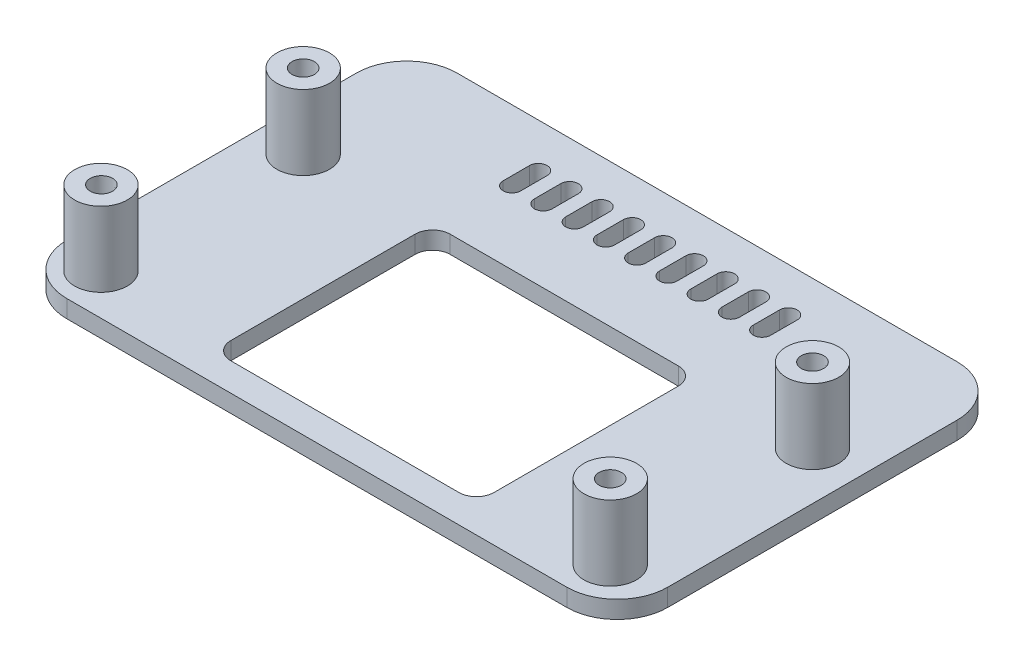
from build123d import *

# Parameters (mm, degrees)
SKETCH_1_W                    = 68.5
SKETCH_1_H                    = 44.5
EXTRUDE_1_DEPTH               = 2
FILLET_1_R                    = 5.75
SKETCH_2_W                    = 30
SKETCH_2_H                    = 25
CUT_EXTRUDE_1_DEPTH           = 43.75543475
FILLET_2_R                    = 2
SKETCH_3_R                    = 3
EXTRUDE_2_DEPTH               = 8.5
SKETCH_4_R                    = 1.275
CUT_EXTRUDE_2_DEPTH           = 6
CUT_EXTRUDE_2_DRAFT           = -1
CUT_EXTRUDE_2_PROFILE_2_DEPTH = 6
CUT_EXTRUDE_2_PROFILE_2_DRAFT = -1
CUT_EXTRUDE_2_PROFILE_3_DEPTH = 6
CUT_EXTRUDE_2_PROFILE_3_DRAFT = -1
CUT_EXTRUDE_2_PROFILE_4_DEPTH = 6
CUT_EXTRUDE_2_PROFILE_4_DRAFT = -1
CUT_EXTRUDE_3_DEPTH           = 10


with BuildPart() as part:
    # 草图1 → 凸台-拉伸1 (new body)
    with BuildSketch(Plane(origin=(0, 0, 0), x_dir=(1, 0, 0), z_dir=(0, 1, 0))):
        with Locations((-0.249435028, -2.925706215)):
            Rectangle(SKETCH_1_W, SKETCH_1_H)
    extrude(amount=EXTRUDE_1_DEPTH)

    # 圆角1
    fillet_1_edges = [part.edges().sort_by_distance(p)[0] for p in [
        (34.000564972, 1, -19.324293785),
        (34.000564972, 1, 25.175706215),
        (-34.499435028, 1, 25.175706215),
        (-34.499435028, 1, -19.324293785),
    ]]
    fillet(fillet_1_edges, radius=FILLET_1_R)

    # 草图2 → 切除-拉伸1 (cut, through all)
    with BuildSketch(Plane.XZ):
        with Locations((-0.249435028, 9.475706215)):
            Rectangle(SKETCH_2_W, SKETCH_2_H)
    extrude(amount=-CUT_EXTRUDE_1_DEPTH, mode=Mode.SUBTRACT)

    # 圆角2
    fillet_2_edges = [part.edges().sort_by_distance(p)[0] for p in [
        (-15.249435028, 1, -3.024293785),
        (-15.249435028, 1, 21.975706215),
        (14.750564972, 1, 21.975706215),
        (14.750564972, 1, -3.024293785),
    ]]
    fillet(fillet_2_edges, radius=FILLET_2_R)

    # 草图3 → 凸台-拉伸2 (add)
    with BuildSketch(Plane(origin=(0, 2, 0), x_dir=(1, 0, 0), z_dir=(0, 1, 0))):
        with Locations((-29.524435028, 2.549293785)):
            Circle(SKETCH_3_R)
        with Locations((-29.524435028, -20.500706215)):
            Circle(SKETCH_3_R)
        with Locations((28.500564972, -20.475706215)):
            Circle(SKETCH_3_R)
        with Locations((28.525564972, 2.549293785)):
            Circle(SKETCH_3_R)
    extrude(amount=EXTRUDE_2_DEPTH)


with BuildPart() as cut_extrude_2_tool:
    # 草图4 → 切除-拉伸2 (with draft: the straight prism first)
    with BuildSketch(Plane(origin=(0, 10.5, 0), x_dir=(1, 0, 0), z_dir=(0, 1, 0))):
        with Locations((-29.524435028, 2.549293785)):
            Circle(SKETCH_4_R)
    extrude(amount=-CUT_EXTRUDE_2_DEPTH)
    # 切除-拉伸2: the draft: its side faces are tilted about the plane it starts from
    cut_extrude_2_sides = [cut_extrude_2_tool.faces().sort_by_distance(p)[0] for p in [
        (-30.799435028, 7.5, -2.549293785),
    ]]
    draft(cut_extrude_2_sides, Plane(origin=(0, 10.5, 0), x_dir=(1, 0, 0), z_dir=(0, 1, 0)), CUT_EXTRUDE_2_DRAFT)


with BuildPart() as part_1:
    add(part.part)

    # 切除-拉伸2: cut by cut_extrude_2_tool
    add(cut_extrude_2_tool.part, mode=Mode.SUBTRACT)


with BuildPart() as cut_extrude_2_profile_2_tool:
    # 草图4 → 切除-拉伸2 profile 2 (with draft: the straight prism first)
    with BuildSketch(Plane(origin=(0, 10.5, 0), x_dir=(1, 0, 0), z_dir=(0, 1, 0))):
        with Locations((-29.499435028, -20.475706215)):
            Circle(SKETCH_4_R)
    extrude(amount=-CUT_EXTRUDE_2_PROFILE_2_DEPTH)
    # 切除-拉伸2 profile 2: the draft: its side faces are tilted about the plane it starts from
    cut_extrude_2_profile_2_sides = [cut_extrude_2_profile_2_tool.faces().sort_by_distance(p)[0] for p in [
        (-30.774435028, 7.5, 20.475706215),
    ]]
    draft(cut_extrude_2_profile_2_sides, Plane(origin=(0, 10.5, 0), x_dir=(1, 0, 0), z_dir=(0, 1, 0)), CUT_EXTRUDE_2_PROFILE_2_DRAFT)


with BuildPart() as part_2:
    add(part_1.part)

    # 切除-拉伸2 profile 2: cut by cut_extrude_2_profile_2_tool
    add(cut_extrude_2_profile_2_tool.part, mode=Mode.SUBTRACT)


with BuildPart() as cut_extrude_2_profile_3_tool:
    # 草图4 → 切除-拉伸2 profile 3 (with draft: the straight prism first)
    with BuildSketch(Plane(origin=(0, 10.5, 0), x_dir=(1, 0, 0), z_dir=(0, 1, 0))):
        with Locations((28.525564972, -20.500706215)):
            Circle(SKETCH_4_R)
    extrude(amount=-CUT_EXTRUDE_2_PROFILE_3_DEPTH)
    # 切除-拉伸2 profile 3: the draft: its side faces are tilted about the plane it starts from
    cut_extrude_2_profile_3_sides = [cut_extrude_2_profile_3_tool.faces().sort_by_distance(p)[0] for p in [
        (27.250564972, 7.5, 20.500706215),
    ]]
    draft(cut_extrude_2_profile_3_sides, Plane(origin=(0, 10.5, 0), x_dir=(1, 0, 0), z_dir=(0, 1, 0)), CUT_EXTRUDE_2_PROFILE_3_DRAFT)


with BuildPart() as part_3:
    add(part_2.part)

    # 切除-拉伸2 profile 3: cut by cut_extrude_2_profile_3_tool
    add(cut_extrude_2_profile_3_tool.part, mode=Mode.SUBTRACT)


with BuildPart() as cut_extrude_2_profile_4_tool:
    # 草图4 → 切除-拉伸2 profile 4 (with draft: the straight prism first)
    with BuildSketch(Plane(origin=(0, 10.5, 0), x_dir=(1, 0, 0), z_dir=(0, 1, 0))):
        with Locations((28.525564972, 2.549293785)):
            Circle(SKETCH_4_R)
    extrude(amount=-CUT_EXTRUDE_2_PROFILE_4_DEPTH)
    # 切除-拉伸2 profile 4: the draft: its side faces are tilted about the plane it starts from
    cut_extrude_2_profile_4_sides = [cut_extrude_2_profile_4_tool.faces().sort_by_distance(p)[0] for p in [
        (27.250564972, 7.5, -2.549293785),
    ]]
    draft(cut_extrude_2_profile_4_sides, Plane(origin=(0, 10.5, 0), x_dir=(1, 0, 0), z_dir=(0, 1, 0)), CUT_EXTRUDE_2_PROFILE_4_DRAFT)


with BuildPart() as part_4:
    add(part_3.part)

    # 切除-拉伸2 profile 4: cut by cut_extrude_2_profile_4_tool
    add(cut_extrude_2_profile_4_tool.part, mode=Mode.SUBTRACT)

    # 草图5 → 切除-拉伸3 (cut)
    with BuildSketch(Plane.XZ):
        with BuildLine():
            Line((-13.499435028, -11.324293785), (-13.499435028, -14.324293785))
            ThreePointArc((-13.499435028, -14.324293785), (-14.499435028, -15.324293785), (-15.499435028, -14.324293785))
            Line((-15.499435028, -14.324293785), (-15.499435028, -11.324293785))
            ThreePointArc((-15.499435028, -11.324293785), (-14.499435028, -10.324293785), (-13.499435028, -11.324293785))
        make_face()
        with BuildLine():
            Line((-9.936935028, -11.324293785), (-9.936935028, -14.324293785))
            ThreePointArc((-9.936935028, -14.324293785), (-10.936935028, -15.324293785), (-11.936935028, -14.324293785))
            Line((-11.936935028, -14.324293785), (-11.936935028, -11.324293785))
            ThreePointArc((-11.936935028, -11.324293785), (-10.936935028, -10.324293785), (-9.936935028, -11.324293785))
        make_face()
        with BuildLine():
            Line((-6.374435028, -11.324293785), (-6.374435028, -14.324293785))
            ThreePointArc((-6.374435028, -14.324293785), (-7.374435028, -15.324293785), (-8.374435028, -14.324293785))
            Line((-8.374435028, -14.324293785), (-8.374435028, -11.324293785))
            ThreePointArc((-8.374435028, -11.324293785), (-7.374435028, -10.324293785), (-6.374435028, -11.324293785))
        make_face()
        with BuildLine():
            Line((-2.811935028, -11.324293785), (-2.811935028, -14.324293785))
            ThreePointArc((-2.811935028, -14.324293785), (-3.811935028, -15.324293785), (-4.811935028, -14.324293785))
            Line((-4.811935028, -14.324293785), (-4.811935028, -11.324293785))
            ThreePointArc((-4.811935028, -11.324293785), (-3.811935028, -10.324293785), (-2.811935028, -11.324293785))
        make_face()
        with BuildLine():
            Line((0.750564972, -11.324293785), (0.750564972, -14.324293785))
            ThreePointArc((0.750564972, -14.324293785), (-0.249435028, -15.324293785), (-1.249435028, -14.324293785))
            Line((-1.249435028, -14.324293785), (-1.249435028, -11.324293785))
            ThreePointArc((-1.249435028, -11.324293785), (-0.249435028, -10.324293785), (0.750564972, -11.324293785))
        make_face()
        with BuildLine():
            Line((4.313064972, -11.324293785), (4.313064972, -14.324293785))
            ThreePointArc((4.313064972, -14.324293785), (3.313064972, -15.324293785), (2.313064972, -14.324293785))
            Line((2.313064972, -14.324293785), (2.313064972, -11.324293785))
            ThreePointArc((2.313064972, -11.324293785), (3.313064972, -10.324293785), (4.313064972, -11.324293785))
        make_face()
        with BuildLine():
            Line((7.875564972, -11.324293785), (7.875564972, -14.324293785))
            ThreePointArc((7.875564972, -14.324293785), (6.875564972, -15.324293785), (5.875564972, -14.324293785))
            Line((5.875564972, -14.324293785), (5.875564972, -11.324293785))
            ThreePointArc((5.875564972, -11.324293785), (6.875564972, -10.324293785), (7.875564972, -11.324293785))
        make_face()
        with BuildLine():
            Line((11.438064972, -11.324293785), (11.438064972, -14.324293785))
            ThreePointArc((11.438064972, -14.324293785), (10.438064972, -15.324293785), (9.438064972, -14.324293785))
            Line((9.438064972, -14.324293785), (9.438064972, -11.324293785))
            ThreePointArc((9.438064972, -11.324293785), (10.438064972, -10.324293785), (11.438064972, -11.324293785))
        make_face()
        with BuildLine():
            Line((15.000564972, -11.324293785), (15.000564972, -14.324293785))
            ThreePointArc((15.000564972, -14.324293785), (14.000564972, -15.324293785), (13.000564972, -14.324293785))
            Line((13.000564972, -14.324293785), (13.000564972, -11.324293785))
            ThreePointArc((13.000564972, -11.324293785), (14.000564972, -10.324293785), (15.000564972, -11.324293785))
        make_face()
    extrude(amount=-CUT_EXTRUDE_3_DEPTH, mode=Mode.SUBTRACT)


solid = part_4.part
